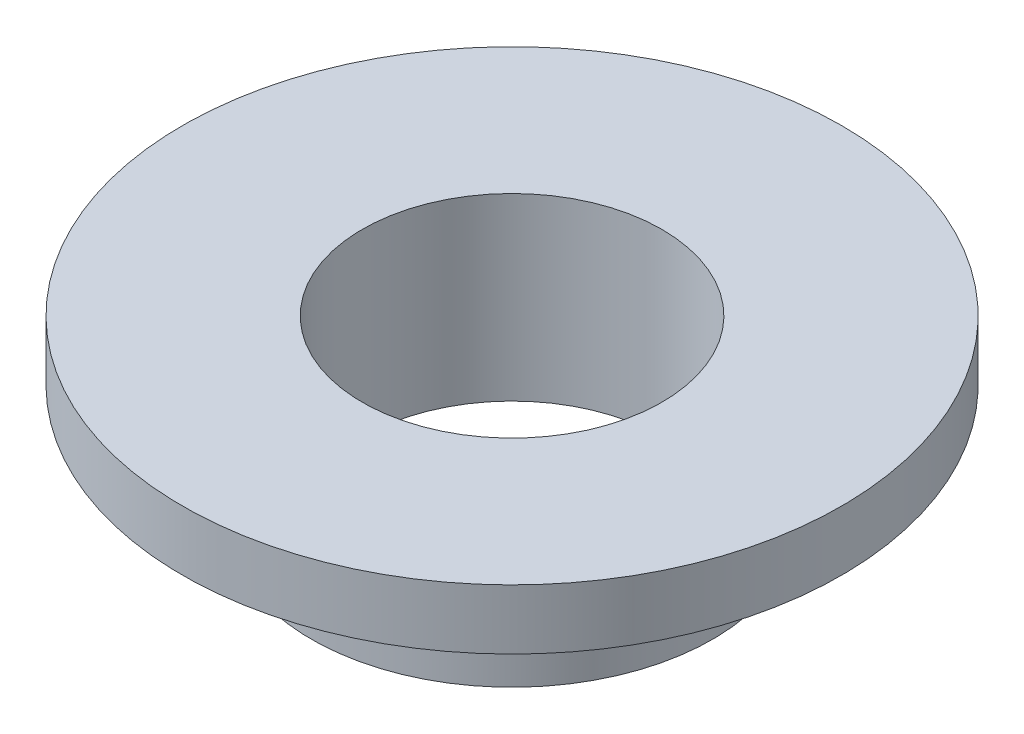
from build123d import *


with BuildPart() as part:
    # Эскиз1 → Повернуть1 (revolve)
    with BuildSketch(Plane.XY):
        Polygon((5, 0), (5, 6), (11, 6), (11, 4), (6.7, 4), (6.7, 0), align=None)
    revolve(axis=Axis((0, 0, 0), (0, 1, 0)))


solid = part.part
